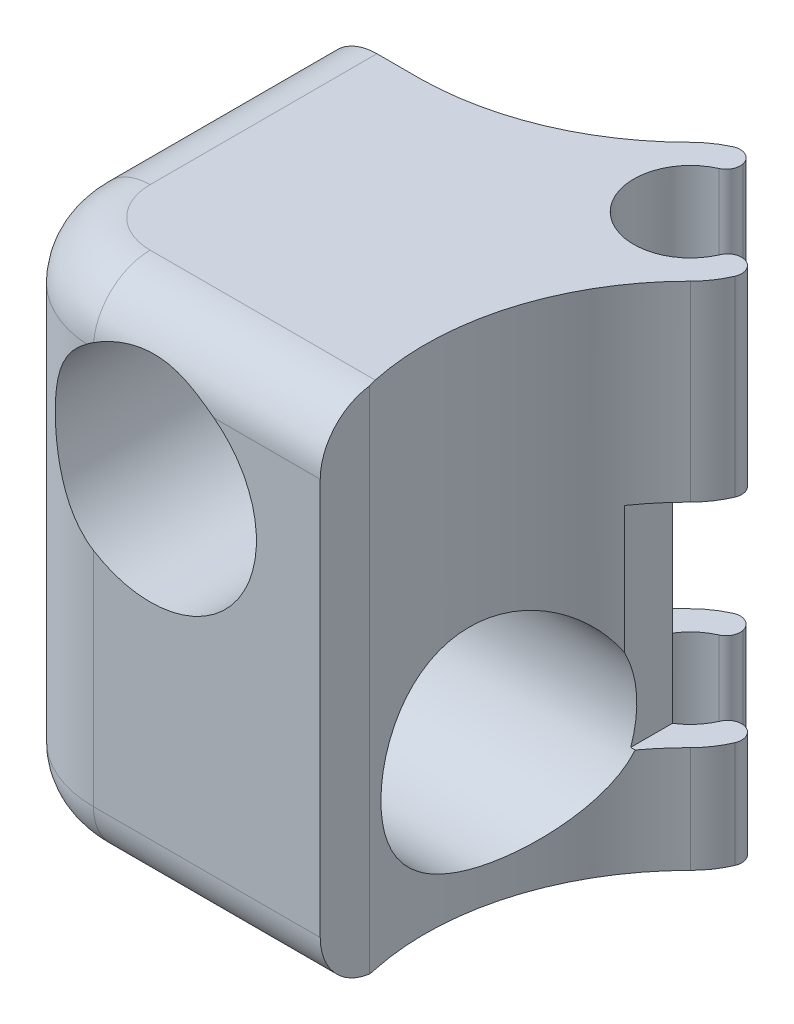
from build123d import *

# Parameters (mm, degrees)
BOSS_EXTRUDE1_DEPTH = 36
SKETCH2_R           = 7.5
CUT_EXTRUDE1_DEPTH  = 51.950145011
SKETCH3_R           = 7.5
CUT_EXTRUDE2_DEPTH  = 52.231763324
FILLET1_R           = 8
FILLET2_R           = 4
FILLET3_R           = 1
FILLET4_R           = 1
CUT_EXTRUDE3_DEPTH  = 7.5


# Some blends are built 0.0001 mm under size
with BuildPart() as part:
    # Sketch1 → Boss-Extrude1 (new body)
    with BuildSketch(Plane(origin=(0, 0, 0), x_dir=(1, 0, 0), z_dir=(0, 1, 0))):
        with BuildLine():
            Line((12.166155414, -12.166155414), (-11.833844586, -12.166155414))
            Line((-11.833844586, -12.166155414), (-11.833844586, 11.833844586))
            Line((-11.833844586, 11.833844586), (-4.753315898, 11.833844586))
            ThreePointArc((-4.753315898, 11.833844586), (2.492071873, 13.348010377), (8.633253511, 17.480107918))
            ThreePointArc((8.633253511, 17.480107918), (9.98514832, 18.495184251), (11.566536194, 19.09285634))
            Line((11.566536194, 19.09285634), (12.002988862, 17.14105997))
            ThreePointArc((12.002988862, 17.14105997), (10.068614763, 10.388049365), (16.792058069, 12.422813601))
            Line((16.792058069, 12.422813601), (18.750140005, 12.015486787))
            ThreePointArc((18.750140005, 12.015486787), (18.154998777, 10.385966776), (17.118534885, 8.994826544))
            ThreePointArc((17.118534885, 8.994826544), (12.32659232, 0.801901017), (12.166155414, -8.688146518))
            Line((12.166155414, -8.688146518), (12.166155414, -12.166155414))
        make_face()
    extrude(amount=BOSS_EXTRUDE1_DEPTH)

    # Sketch2 → Cut-Extrude1 (cut, through all)
    with BuildSketch(Plane.ZY.offset(11.833844586)):
        with Locations((0.166155414, 10)):
            Circle(SKETCH2_R)
    extrude(amount=-CUT_EXTRUDE1_DEPTH, mode=Mode.SUBTRACT)

    # Sketch3 → Cut-Extrude2 (cut, through all)
    with BuildSketch(Plane.XY.offset(12.166155414)):
        with Locations((0.166155414, 26)):
            Circle(SKETCH3_R)
    extrude(amount=-CUT_EXTRUDE2_DEPTH, mode=Mode.SUBTRACT)

    # Fillet1
    # the kernel refuses this fillet: 8 mm, written as the material it takes off along each edge
    with BuildSketch(Plane(origin=(-11.833844586, -20, 12.166155414), x_dir=(1, 0, 0), z_dir=(0, 1, 0))) as fillet1_piece_1:
        with BuildLine():
            CenterArc((FILLET1_R, FILLET1_R), FILLET1_R, 180, 90)
            Line((0, FILLET1_R), (0, 0))
            Line((0, 0), (FILLET1_R, 0))
        make_face()
    extrude(amount=76, mode=Mode.SUBTRACT)

    # Fillet2
    # the kernel refuses this fillet: 4 mm, written as the material it takes off along each edge
    with BuildSketch(Plane(origin=(-11.833844586, 0, 4.166155414), x_dir=(1, 0, 0), z_dir=(0, 0, -1)), Plane(origin=(22.166155414, 36, 12.166155414), x_dir=(0, -1, 0), z_dir=(-1, 0, 0))) as fillet2_piece_1:
        with BuildLine():
            CenterArc((FILLET2_R, -FILLET2_R), FILLET2_R, 90, 90)
            Line((0, -FILLET2_R), (0, 0))
            Line((0, 0), (FILLET2_R, 0))
        make_face()
    extrude(amount=26, mode=Mode.SUBTRACT)
    with BuildSketch(Plane(origin=(-3.833844586, 0, 4.166155414), x_dir=(0, 0, 1), z_dir=(1, 0, 0))) as fillet2_piece_2:
        with BuildLine():
            CenterArc((8 - FILLET2_R, -FILLET2_R), FILLET2_R, 0, 90)
            Line((8, -FILLET2_R), (8, 0))
            Line((8, 0), (8 - FILLET2_R, 0))
        make_face()
    revolve(axis=Axis((-3.833844586, 0, 4.166155414), (0, -1, 0)), revolution_arc=90, mode=Mode.SUBTRACT)
    with BuildSketch(Plane(origin=(-3.833844586, 36, 4.166155414), x_dir=(0, 0, 1), z_dir=(1, 0, 0))) as fillet2_piece_3:
        with BuildLine():
            CenterArc((8 - FILLET2_R, FILLET2_R), FILLET2_R, 270, 90)
            Line((8, FILLET2_R), (8, 0))
            Line((8, 0), (8 - FILLET2_R, 0))
        make_face()
    revolve(axis=Axis((-3.833844586, 36, 4.166155414), (0, -1, 0)), revolution_arc=90, mode=Mode.SUBTRACT)
    with BuildSketch(Plane(origin=(22.166155414, 0, 12.166155414), x_dir=(0, 1, 0), z_dir=(-1, 0, 0)), Plane(origin=(-11.833844586, 36, 4.166155414), x_dir=(1, 0, 0), z_dir=(0, 0, -1))) as fillet2_piece_4:
        with BuildLine():
            CenterArc((FILLET2_R, FILLET2_R), FILLET2_R, 180, 90)
            Line((0, FILLET2_R), (0, 0))
            Line((0, 0), (FILLET2_R, 0))
        make_face()
    extrude(amount=26, mode=Mode.SUBTRACT)

    # Fillet3
    fillet3_edges = [part.edges().sort_by_distance(p)[0] for p in [
        (12.002988862, 18, -17.14105997),
        (16.792058069, 18, -12.422813601),
    ]]
    fillet(fillet3_edges, radius=FILLET3_R)

    # Fillet4
    fillet4_edges = [part.edges().sort_by_distance(p)[0] for p in [
        (11.566536194, 18, -19.09285634),
        (18.750140005, 18, -12.015486787),
    ]]
    fillet(fillet4_edges, radius=FILLET4_R - 0.0001)  # a hair under: the kernel refuses the full size

    # Sketch4 → Cut-Extrude3 (cut, symmetric)
    with BuildSketch(Plane(origin=(0, 15, 0), x_dir=(1, 0, 0), z_dir=(0, 1, 0))):
        Polygon((15, 15), (15, 0), (27.823989989, 3.609418598), (23.424788661, 30.402201484), (6.171676897, 29.445037867), (0, 15), align=None)
    extrude(amount=CUT_EXTRUDE3_DEPTH, both=True, mode=Mode.SUBTRACT)


solid = part.part
